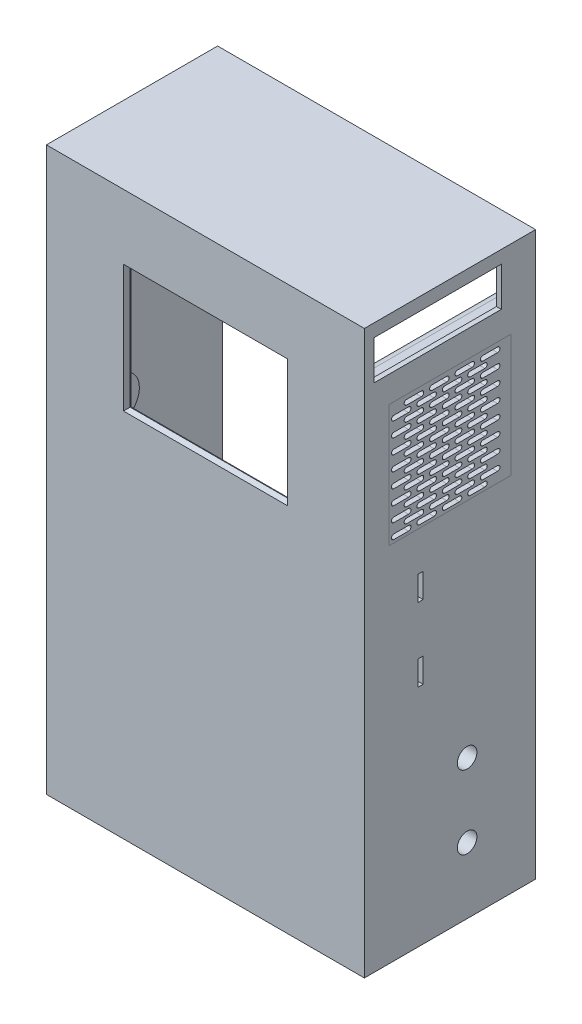
from build123d import *

# Parameters (mm, degrees)
SKETCH1_W                = 130
SKETCH1_H                = 230
CASE_2_DEPTH             = 70
CASE_SHELL_T             = -2
MONITOR_CUTOUT_REACH     = 151.499
SKETCH2_W                = 65
SKETCH2_H                = 50
SKETCH3_R                = 2.5
SKETCH3_R_2              = 1
MONITOR_STAND_DEPTH      = 4
MONITOR_CUTOUT_RIM_SIZE  = 1
MONITOR_CUTOUT_RIM_SIZE2 = 1.732050808
SKETCH17_R               = 4
PTC_HOLES_DEPTH          = 186.765981816
SKETCH27_R               = 3
BOSS_EXTRUDE5_DEPTH      = 2
BOSS_EXTRUDE6_START      = 4
BOSS_EXTRUDE6_DEPTH      = 2
SKETCH29_R               = 1
CUT_EXTRUDE8_DEPTH       = 3
CUT_EXTRUDE9_REACH       = 187.766
SKETCH30_W               = 52
SKETCH30_H               = 16
CUT_EXTRUDE10_REACH      = 187.766
SKETCH31_R               = 4
SKETCH33_W               = 8
SKETCH33_H               = 8
SKETCH33_R               = 1.5
BOSS_EXTRUDE8_DEPTH      = 68
FILLET1_R                = 4
EXTRUDE_THIN1_START      = 90
SKETCH15_W               = 10
SKETCH15_H               = 20
EXTRUDE_THIN1_DEPTH      = 40
SKETCH35_R               = 1.5
CUT_EXTRUDE11_DEPTH      = 10
CUT_EXTRUDE12_REACH      = 189.15
SKETCH36_W               = 2
SKETCH36_H               = 10
REVOLVE1_ANGLE           = 90
CUT_EXTRUDE15_REACH      = 151.499
SKETCH46_R               = 1.5
EXTRUDE_THIN2_START      = 5
SKETCH47_R               = 9
SKETCH47_R_2             = 4
EXTRUDE_THIN2_DEPTH      = 5
EXTRUDE_THIN3_START      = 5
SKETCH48_R               = 9
SKETCH48_R_2             = 4
EXTRUDE_THIN3_DEPTH      = 5
CUT_EXTRUDE16_REACH      = 189.15
FILL_START               = 63
FILL_PATTERN1_DEPTH      = 2


# Read off the part's stored shape, not the designer's step: Fill Pattern1
with BuildPart() as part:
    # Sketch1 → Case 2 (new body)
    with BuildSketch(Plane.XY):
        Rectangle(SKETCH1_W, SKETCH1_H)
    extrude(amount=CASE_2_DEPTH)

    # Case Shell
    case_shell_openings = [part.faces().sort_by_distance(p)[0] for p in [
        (0, 0, 0),
    ]]
    offset(amount=CASE_SHELL_T, openings=case_shell_openings, kind=Kind.INTERSECTION)

    # Sketch2 → Monitor Cutout (cut, up to next)
    with BuildSketch(Plane.XY.offset(70), mode=Mode.PRIVATE) as monitor_cutout_sk1:
        with Locations((0, 62.5)):
            Rectangle(SKETCH2_W, SKETCH2_H)
    monitor_cutout_tool1 = extrude(monitor_cutout_sk1.sketch, amount=-MONITOR_CUTOUT_REACH, mode=Mode.PRIVATE) & part.part
    add(monitor_cutout_tool1.solids().sort_by_distance((0, 62.5, 70))[0], mode=Mode.SUBTRACT)

    # Sketch3 → Monitor Stand (add)
    # profile 1 of 4: a face of its own
    with BuildSketch(Plane(origin=(0, 0, 68), x_dir=(-1, 0, 0), z_dir=(0, 0, -1))):
        with Locations(Location((43, 78.5, 0), (0, 0, 180))):
            Circle(SKETCH3_R)
        with Locations((43, 78.5)):
            Circle(SKETCH3_R_2, mode=Mode.SUBTRACT)
    # profile 2 of 4: a face of its own
    with BuildSketch(Plane(origin=(0, 0, 68), x_dir=(-1, 0, 0), z_dir=(0, 0, -1))):
        with Locations(Location((43, 46.5, 0), (0, 0, 180))):
            Circle(SKETCH3_R)
        with Locations((43, 46.5)):
            Circle(SKETCH3_R_2, mode=Mode.SUBTRACT)
    # profile 3 of 4: a face of its own
    with BuildSketch(Plane(origin=(0, 0, 68), x_dir=(-1, 0, 0), z_dir=(0, 0, -1))):
        with Locations(Location((-43, 46.5, 0), (0, 0, 180))):
            Circle(SKETCH3_R)
        with Locations((-43, 46.5)):
            Circle(SKETCH3_R_2, mode=Mode.SUBTRACT)
    # profile 4 of 4: a face of its own
    with BuildSketch(Plane(origin=(0, 0, 68), x_dir=(-1, 0, 0), z_dir=(0, 0, -1))):
        with Locations(Location((-43, 78.5, 0), (0, 0, 180))):
            Circle(SKETCH3_R)
        with Locations((-43, 78.5)):
            Circle(SKETCH3_R_2, mode=Mode.SUBTRACT)
    extrude(amount=MONITOR_STAND_DEPTH)

    # Monitor Cutout Rim
    monitor_cutout_rim_edges = [part.edges().sort_by_distance(p)[0] for p in [
        (32.5, 62.5, 70),
        (0, 87.5, 70),
        (-32.5, 62.5, 70),
        (0, 37.5, 70),
    ]]
    monitor_cutout_rim_side = [part.faces().sort_by_distance(p)[0] for p in [
        (0, -7.62195122, 70),
    ]]
    chamfer(monitor_cutout_rim_edges, length=MONITOR_CUTOUT_RIM_SIZE, length2=MONITOR_CUTOUT_RIM_SIZE2, reference=monitor_cutout_rim_side[0])

    # Sketch17 → PTC Holes (cut, through all)
    with BuildSketch(Plane.ZY.offset(-63)):
        with Locations(Location((28, -58, 0), (0, 0, 270))):
            Circle(SKETCH17_R)
        with Locations(Location((28, -88, 0), (0, 0, 270))):
            Circle(SKETCH17_R)
    extrude(amount=-PTC_HOLES_DEPTH, mode=Mode.SUBTRACT)

    # Sketch27 → Boss-Extrude5 (add)
    with BuildSketch(Plane.XZ.offset(-113)):
        with Locations(Location((39.5, 15.5, 0), (0, 0, 270))):
            Circle(SKETCH27_R)
        with Locations(Location((-18.5, 15.5, 0), (0, 0, 270))):
            Circle(SKETCH27_R)
        with BuildLine():
            Line((-21.5, 64.5), (-21.5, 68))
            Line((-21.5, 68), (-15.5, 68))
            Line((-15.5, 68), (-15.5, 64.5))
            ThreePointArc((-15.5, 64.5), (-18.5, 61.5), (-21.5, 64.5))
        make_face()
        with BuildLine():
            Line((36.5, 64.5), (36.5, 68))
            Line((36.5, 68), (42.5, 68))
            Line((42.5, 68), (42.5, 64.5))
            ThreePointArc((42.5, 64.5), (39.5, 61.5), (36.5, 64.5))
        make_face()
    extrude(amount=BOSS_EXTRUDE5_DEPTH)

    # Sketch28 → Boss-Extrude6 (add)
    with BuildSketch(Plane.XZ.offset(-113).offset(BOSS_EXTRUDE6_START)):
        with BuildLine():
            Line((-15.5, 64.5), (-15.5, 68))
            Line((-15.5, 68), (-21.5, 68))
            Line((-21.5, 68), (-21.5, 64.5))
            ThreePointArc((-21.5, 64.5), (-18.5, 61.5), (-15.5, 64.5))
        make_face()
        with BuildLine():
            Line((42.5, 64.5), (42.5, 68))
            Line((42.5, 68), (36.5, 68))
            Line((36.5, 68), (36.5, 64.5))
            ThreePointArc((36.5, 64.5), (39.5, 61.5), (42.5, 64.5))
        make_face()
    extrude(amount=BOSS_EXTRUDE6_DEPTH)

    # Sketch29 → Cut-Extrude8 (cut)
    with BuildSketch(Plane.XZ.offset(-111)):
        with Locations(Location((39.5, 15.5, 0), (0, 0, 270))):
            Circle(SKETCH29_R)
        with Locations(Location((-18.5, 15.5, 0), (0, 0, 270))):
            Circle(SKETCH29_R)
    extrude(amount=-CUT_EXTRUDE8_DEPTH, mode=Mode.SUBTRACT)

    # Sketch30 → Cut-Extrude9 (cut, up to next)
    with BuildSketch(Plane.ZY.offset(-63), mode=Mode.PRIVATE) as cut_extrude9_sk1:
        with Locations((40, 101.75)):
            Rectangle(SKETCH30_W, SKETCH30_H)
    cut_extrude9_tool1 = extrude(cut_extrude9_sk1.sketch, amount=-CUT_EXTRUDE9_REACH, mode=Mode.PRIVATE) & part.part
    add(cut_extrude9_tool1.solids().sort_by_distance((63, 101.75, 40))[0], mode=Mode.SUBTRACT)

    # Sketch31 → Cut-Extrude10 (cut, up to next)
    with BuildSketch(Plane(origin=(-63, 0, 0), x_dir=(0, 0, -1), z_dir=(1, 0, 0)), mode=Mode.PRIVATE) as cut_extrude10_sk1:
        with Locations(Location((-48, 17, 0), (0, 0, 90))):
            Circle(SKETCH31_R)
    cut_extrude10_tool1 = extrude(cut_extrude10_sk1.sketch, amount=-CUT_EXTRUDE10_REACH, mode=Mode.PRIVATE) & part.part
    add(cut_extrude10_tool1.solids().sort_by_distance((-63, 17, 48))[0], mode=Mode.SUBTRACT)

    # Sketch33 → Boss-Extrude8 (add)
    # profile 1 of 3: a face of its own
    with BuildSketch(Plane(origin=(0, 0, 0), x_dir=(-1, 0, 0), z_dir=(0, 0, -1))):
        with Locations((59, -109)):
            Rectangle(SKETCH33_W, SKETCH33_H)
        with Locations((59, -109)):
            Circle(SKETCH33_R, mode=Mode.SUBTRACT)
    # profile 2 of 3: a face of its own
    with BuildSketch(Plane(origin=(0, 0, 0), x_dir=(-1, 0, 0), z_dir=(0, 0, -1))):
        with Locations((59, 109)):
            Rectangle(SKETCH33_W, SKETCH33_H)
        with Locations((59, 109)):
            Circle(SKETCH33_R, mode=Mode.SUBTRACT)
    # profile 3 of 3: a face of its own
    with BuildSketch(Plane(origin=(0, 0, 0), x_dir=(-1, 0, 0), z_dir=(0, 0, -1))):
        with Locations((-59, 89)):
            Rectangle(SKETCH33_W, SKETCH33_H)
        with Locations((-59, 89)):
            Circle(SKETCH33_R, mode=Mode.SUBTRACT)
    extrude(amount=-BOSS_EXTRUDE8_DEPTH)

    # Fillet1
    fillet1_edges = [part.edges().sort_by_distance(p)[0] for p in [
        (-55, -105, 34),
        (-55, 105, 34),
        (55, 93, 34),
        (55, 85, 34),
    ]]
    fillet(fillet1_edges, radius=FILLET1_R - 0.0001)  # a hair under: the kernel refuses the full size

    # Sketch15 → Extrude-Thin1 (add)
    with BuildSketch(Plane(origin=(0, -113, 0), x_dir=(1, 0, 0), z_dir=(0, 1, 0)).offset(EXTRUDE_THIN1_START)):
        with Locations((8, -58)):
            Rectangle(SKETCH15_W, SKETCH15_H)
    extrude(amount=EXTRUDE_THIN1_DEPTH)

    # Sketch35 → Cut-Extrude11 (cut)
    with BuildSketch(Plane(origin=(0, 0, 48), x_dir=(-1, 0, 0), z_dir=(0, 0, -1))):
        with Locations((-8, 13)):
            Circle(SKETCH35_R)
        with Locations((-8, -19)):
            Circle(SKETCH35_R)
    extrude(amount=-CUT_EXTRUDE11_DEPTH, mode=Mode.SUBTRACT)

    # Sketch36 → Cut-Extrude12 (cut, up to next)
    with BuildSketch(Plane(origin=(65, 0, 0), x_dir=(0, 0, -1), z_dir=(1, 0, 0)), mode=Mode.PRIVATE) as cut_extrude12_sk1:
        with Locations((-47, 12)):
            Rectangle(SKETCH36_W, SKETCH36_H)
    cut_extrude12_tool1 = extrude(cut_extrude12_sk1.sketch, amount=-CUT_EXTRUDE12_REACH, mode=Mode.PRIVATE) & part.part
    # Sketch36 → Cut-Extrude12 (cut, up to next)
    with BuildSketch(Plane(origin=(65, 0, 0), x_dir=(0, 0, -1), z_dir=(1, 0, 0)), mode=Mode.PRIVATE) as cut_extrude12_sk2:
        with Locations((-47, -18)):
            Rectangle(SKETCH36_W, SKETCH36_H)
    cut_extrude12_tool2 = extrude(cut_extrude12_sk2.sketch, amount=-CUT_EXTRUDE12_REACH, mode=Mode.PRIVATE) & part.part
    add(cut_extrude12_tool1.solids().sort_by_distance((65, 12, 47))[0], mode=Mode.SUBTRACT)
    add(cut_extrude12_tool2.solids().sort_by_distance((65, -18, 47))[0], mode=Mode.SUBTRACT)

    # Sketch45 → Revolve1 (revolve)
    with BuildSketch(Plane(origin=(0, -113, 0), x_dir=(1, 0, 0), z_dir=(0, 1, 0))):
        with BuildLine():
            Line((63, 0), (48, 0))
            Line((48, 0), (48, -7.129153252))
            add(Edge.make_bspline(
                [(48, -7.129153252), (61.418377024, -15.580069757), (63, -33.841342958), (63, -48)],
                knots=[0, 0, 0, 0, 1, 1, 1, 1], degree=3))
            Line((63, -48), (63, 0))
        make_face()
    revolve(axis=Axis((63, -113, 48), (0, 0, -1)), revolution_arc=REVOLVE1_ANGLE)

    # Sketch46 → Cut-Extrude15 (cut, up to next)
    with BuildSketch(Plane(origin=(0, 0, 0), x_dir=(-1, 0, 0), z_dir=(0, 0, -1)), mode=Mode.PRIVATE) as cut_extrude15_sk1:
        with Locations((-59, -109)):
            Circle(SKETCH46_R)
    cut_extrude15_tool1 = extrude(cut_extrude15_sk1.sketch, amount=-CUT_EXTRUDE15_REACH, mode=Mode.PRIVATE) & part.part
    # Sketch46 → Cut-Extrude15 (cut, up to next)
    with BuildSketch(Plane(origin=(0, 0, 0), x_dir=(-1, 0, 0), z_dir=(0, 0, -1)), mode=Mode.PRIVATE) as cut_extrude15_sk2:
        with BuildLine():
            Line((-63, -105), (-59, -105))
            ThreePointArc((-59, -105), (-56.171572875, -106.171572875), (-55, -109))
            Line((-55, -109), (-55, -113))
            Line((-55, -113), (-42.52749649, -113))
            Line((-42.52749649, -113), (-42.52749649, -93.1550439))
            Line((-42.52749649, -93.1550439), (-63, -93.1550439))
            Line((-63, -93.1550439), (-63, -105))
        make_face()
    cut_extrude15_tool2 = extrude(cut_extrude15_sk2.sketch, amount=-CUT_EXTRUDE15_REACH, mode=Mode.PRIVATE) & part.part
    add(cut_extrude15_tool1.solids().sort_by_distance((59, -109, 0))[0], mode=Mode.SUBTRACT)
    add(cut_extrude15_tool2.solids().sort_by_distance((51.640338, -102.009083, 0))[0], mode=Mode.SUBTRACT)

    # Sketch47 → Extrude-Thin2 (add)
    with BuildSketch(Plane(origin=(-63, 0, 0), x_dir=(0, 0, -1), z_dir=(1, 0, 0)).offset(EXTRUDE_THIN2_START)):
        with Locations((-48, 17)):
            Circle(SKETCH47_R)
        with Locations((-48, 17)):
            Circle(SKETCH47_R_2, mode=Mode.SUBTRACT)
    extrude(amount=-EXTRUDE_THIN2_DEPTH)

    # Sketch48 → Extrude-Thin3 (add)
    # profile 1 of 2: a face of its own
    with BuildSketch(Plane.ZY.offset(-63).offset(EXTRUDE_THIN3_START)):
        with Locations((28, -88)):
            Circle(SKETCH48_R)
        with Locations((28, -88)):
            Circle(SKETCH48_R_2, mode=Mode.SUBTRACT)
    # profile 2 of 2: a face of its own
    with BuildSketch(Plane.ZY.offset(-63).offset(EXTRUDE_THIN3_START)):
        with Locations((28, -58)):
            Circle(SKETCH48_R)
        with Locations((28, -58)):
            Circle(SKETCH48_R_2, mode=Mode.SUBTRACT)
    extrude(amount=-EXTRUDE_THIN3_DEPTH)

    # Sketch50 → Cut-Extrude16 (cut, up to next)
    with BuildSketch(Plane(origin=(65, 0, 0), x_dir=(0, 0, -1), z_dir=(1, 0, 0)), mode=Mode.PRIVATE) as cut_extrude16_sk1:
        with BuildLine():
            Line((-47.540283586, 78.217417161), (-41.540283586, 78.217417161))
            ThreePointArc((-41.540283586, 78.217417161), (-40.540283586, 77.217417161), (-41.540283586, 76.217417161))
            Line((-41.540283586, 76.217417161), (-47.540283586, 76.217417161))
            ThreePointArc((-47.540283586, 76.217417161), (-48.540283586, 77.217417161), (-47.540283586, 78.217417161))
        make_face()
    cut_extrude16_tool1 = extrude(cut_extrude16_sk1.sketch, amount=-CUT_EXTRUDE16_REACH, mode=Mode.PRIVATE) & part.part
    add(cut_extrude16_tool1.solids().sort_by_distance((65, 77.217417, 44.540284))[0], mode=Mode.SUBTRACT)

    # Fill Pattern1 outline → Fill Pattern1 (cut)
    with BuildSketch(Plane.YZ.offset(FILL_START)):
        with BuildLine():
            ThreePointArc((76.217417161, 51.932588432), (77.217417161, 50.932588432), (78.217417161, 51.932588432))
            Line((78.217417161, 51.932588432), (78.217417161, 57.932588432))
            ThreePointArc((78.217417161, 57.932588432), (77.217417161, 58.932588432), (76.217417161, 57.932588432))
            Line((76.217417161, 57.932588432), (76.217417161, 51.932588432))
        make_face()
        with BuildLine():
            ThreePointArc((76.217417161, 31.147978741), (77.217417161, 30.147978741), (78.217417161, 31.147978741))
            Line((78.217417161, 31.147978741), (78.217417161, 37.147978741))
            ThreePointArc((78.217417161, 37.147978741), (77.217417161, 38.147978741), (76.217417161, 37.147978741))
            Line((76.217417161, 37.147978741), (76.217417161, 31.147978741))
        make_face()
        with BuildLine():
            ThreePointArc((76.217417161, 20.755673896), (77.217417161, 19.755673896), (78.217417161, 20.755673896))
            Line((78.217417161, 20.755673896), (78.217417161, 26.755673896))
            ThreePointArc((78.217417161, 26.755673896), (77.217417161, 27.755673896), (76.217417161, 26.755673896))
            Line((76.217417161, 26.755673896), (76.217417161, 20.755673896))
        make_face()
        with BuildLine():
            Line((36.217417161, 51.932588432), (36.217417161, 57.932588432))
            ThreePointArc((36.217417161, 57.932588432), (35.217417161, 58.932588432), (34.217417161, 57.932588432))
            Line((34.217417161, 57.932588432), (34.217417161, 51.932588432))
            ThreePointArc((34.217417161, 51.932588432), (35.217417161, 50.932588432), (36.217417161, 51.932588432))
        make_face()
        with BuildLine():
            ThreePointArc((34.217417161, 20.755673896), (35.217417161, 19.755673896), (36.217417161, 20.755673896))
            Line((36.217417161, 20.755673896), (36.217417161, 26.755673896))
            ThreePointArc((36.217417161, 26.755673896), (35.217417161, 27.755673896), (34.217417161, 26.755673896))
            Line((34.217417161, 26.755673896), (34.217417161, 20.755673896))
        make_face()
        with BuildLine():
            ThreePointArc((34.217417161, 31.147978741), (35.217417161, 30.147978741), (36.217417161, 31.147978741))
            Line((36.217417161, 31.147978741), (36.217417161, 37.147978741))
            ThreePointArc((36.217417161, 37.147978741), (35.217417161, 38.147978741), (34.217417161, 37.147978741))
            Line((34.217417161, 37.147978741), (34.217417161, 31.147978741))
        make_face()
        with BuildLine():
            ThreePointArc((34.217417161, 41.540283586), (35.217417161, 40.540283586), (36.217417161, 41.540283586))
            Line((36.217417161, 41.540283586), (36.217417161, 47.540283586))
            ThreePointArc((36.217417161, 47.540283586), (35.217417161, 48.540283586), (34.217417161, 47.540283586))
            Line((34.217417161, 47.540283586), (34.217417161, 41.540283586))
        make_face()
        with BuildLine():
            Line((60.217417161, 20.755673896), (60.217417161, 26.755673896))
            ThreePointArc((60.217417161, 26.755673896), (59.217417161, 27.755673896), (58.217417161, 26.755673896))
            Line((58.217417161, 26.755673896), (58.217417161, 20.755673896))
            ThreePointArc((58.217417161, 20.755673896), (59.217417161, 19.755673896), (60.217417161, 20.755673896))
        make_face()
        with BuildLine():
            ThreePointArc((58.217417161, 31.147978741), (59.217417161, 30.147978741), (60.217417161, 31.147978741))
            Line((60.217417161, 31.147978741), (60.217417161, 37.147978741))
            ThreePointArc((60.217417161, 37.147978741), (59.217417161, 38.147978741), (58.217417161, 37.147978741))
            Line((58.217417161, 37.147978741), (58.217417161, 31.147978741))
        make_face()
        with BuildLine():
            ThreePointArc((58.217417161, 41.540283586), (59.217417161, 40.540283586), (60.217417161, 41.540283586))
            Line((60.217417161, 41.540283586), (60.217417161, 47.540283586))
            ThreePointArc((60.217417161, 47.540283586), (59.217417161, 48.540283586), (58.217417161, 47.540283586))
            Line((58.217417161, 47.540283586), (58.217417161, 41.540283586))
        make_face()
        with BuildLine():
            ThreePointArc((58.217417161, 51.932588432), (59.217417161, 50.932588432), (60.217417161, 51.932588432))
            Line((60.217417161, 51.932588432), (60.217417161, 57.932588432))
            ThreePointArc((60.217417161, 57.932588432), (59.217417161, 58.932588432), (58.217417161, 57.932588432))
            Line((58.217417161, 57.932588432), (58.217417161, 51.932588432))
        make_face()
        with BuildLine():
            Line((63.217417161, 25.951826318), (63.217417161, 31.951826318))
            ThreePointArc((63.217417161, 31.951826318), (62.217417161, 32.951826318), (61.217417161, 31.951826318))
            Line((61.217417161, 31.951826318), (61.217417161, 25.951826318))
            ThreePointArc((61.217417161, 25.951826318), (62.217417161, 24.951826318), (63.217417161, 25.951826318))
        make_face()
        with BuildLine():
            ThreePointArc((61.217417161, 15.559521473), (62.217417161, 14.559521473), (63.217417161, 15.559521473))
            Line((63.217417161, 15.559521473), (63.217417161, 21.559521473))
            ThreePointArc((63.217417161, 21.559521473), (62.217417161, 22.559521473), (61.217417161, 21.559521473))
            Line((61.217417161, 21.559521473), (61.217417161, 15.559521473))
        make_face()
        with BuildLine():
            ThreePointArc((61.217417161, 36.344131164), (62.217417161, 35.344131164), (63.217417161, 36.344131164))
            Line((63.217417161, 36.344131164), (63.217417161, 42.344131164))
            ThreePointArc((63.217417161, 42.344131164), (62.217417161, 43.344131164), (61.217417161, 42.344131164))
            Line((61.217417161, 42.344131164), (61.217417161, 36.344131164))
        make_face()
        with BuildLine():
            ThreePointArc((61.217417161, 46.736436009), (62.217417161, 45.736436009), (63.217417161, 46.736436009))
            Line((63.217417161, 46.736436009), (63.217417161, 52.736436009))
            ThreePointArc((63.217417161, 52.736436009), (62.217417161, 53.736436009), (61.217417161, 52.736436009))
            Line((61.217417161, 52.736436009), (61.217417161, 46.736436009))
        make_face()
        with BuildLine():
            Line((66.217417161, 31.147978741), (66.217417161, 37.147978741))
            ThreePointArc((66.217417161, 37.147978741), (65.217417161, 38.147978741), (64.217417161, 37.147978741))
            Line((64.217417161, 37.147978741), (64.217417161, 31.147978741))
            ThreePointArc((64.217417161, 31.147978741), (65.217417161, 30.147978741), (66.217417161, 31.147978741))
        make_face()
        with BuildLine():
            ThreePointArc((64.217417161, 41.540283586), (65.217417161, 40.540283586), (66.217417161, 41.540283586))
            Line((66.217417161, 41.540283586), (66.217417161, 47.540283586))
            ThreePointArc((66.217417161, 47.540283586), (65.217417161, 48.540283586), (64.217417161, 47.540283586))
            Line((64.217417161, 47.540283586), (64.217417161, 41.540283586))
        make_face()
        with BuildLine():
            ThreePointArc((64.217417161, 20.755673896), (65.217417161, 19.755673896), (66.217417161, 20.755673896))
            Line((66.217417161, 20.755673896), (66.217417161, 26.755673896))
            ThreePointArc((66.217417161, 26.755673896), (65.217417161, 27.755673896), (64.217417161, 26.755673896))
            Line((64.217417161, 26.755673896), (64.217417161, 20.755673896))
        make_face()
        with BuildLine():
            ThreePointArc((64.217417161, 51.932588432), (65.217417161, 50.932588432), (66.217417161, 51.932588432))
            Line((66.217417161, 51.932588432), (66.217417161, 57.932588432))
            ThreePointArc((66.217417161, 57.932588432), (65.217417161, 58.932588432), (64.217417161, 57.932588432))
            Line((64.217417161, 57.932588432), (64.217417161, 51.932588432))
        make_face()
        with BuildLine():
            Line((69.217417161, 36.344131164), (69.217417161, 42.344131164))
            ThreePointArc((69.217417161, 42.344131164), (68.217417161, 43.344131164), (67.217417161, 42.344131164))
            Line((67.217417161, 42.344131164), (67.217417161, 36.344131164))
            ThreePointArc((67.217417161, 36.344131164), (68.217417161, 35.344131164), (69.217417161, 36.344131164))
        make_face()
        with BuildLine():
            ThreePointArc((67.217417161, 46.736436009), (68.217417161, 45.736436009), (69.217417161, 46.736436009))
            Line((69.217417161, 46.736436009), (69.217417161, 52.736436009))
            ThreePointArc((69.217417161, 52.736436009), (68.217417161, 53.736436009), (67.217417161, 52.736436009))
            Line((67.217417161, 52.736436009), (67.217417161, 46.736436009))
        make_face()
        with BuildLine():
            ThreePointArc((67.217417161, 25.951826318), (68.217417161, 24.951826318), (69.217417161, 25.951826318))
            Line((69.217417161, 25.951826318), (69.217417161, 31.951826318))
            ThreePointArc((69.217417161, 31.951826318), (68.217417161, 32.951826318), (67.217417161, 31.951826318))
            Line((67.217417161, 31.951826318), (67.217417161, 25.951826318))
        make_face()
        with BuildLine():
            ThreePointArc((67.217417161, 15.559521473), (68.217417161, 14.559521473), (69.217417161, 15.559521473))
            Line((69.217417161, 15.559521473), (69.217417161, 21.559521473))
            ThreePointArc((69.217417161, 21.559521473), (68.217417161, 22.559521473), (67.217417161, 21.559521473))
            Line((67.217417161, 21.559521473), (67.217417161, 15.559521473))
        make_face()
        with BuildLine():
            Line((75.217417161, 46.736436009), (75.217417161, 52.736436009))
            ThreePointArc((75.217417161, 52.736436009), (74.217417161, 53.736436009), (73.217417161, 52.736436009))
            Line((73.217417161, 52.736436009), (73.217417161, 46.736436009))
            ThreePointArc((73.217417161, 46.736436009), (74.217417161, 45.736436009), (75.217417161, 46.736436009))
        make_face()
        with BuildLine():
            ThreePointArc((73.217417161, 15.559521473), (74.217417161, 14.559521473), (75.217417161, 15.559521473))
            Line((75.217417161, 15.559521473), (75.217417161, 21.559521473))
            ThreePointArc((75.217417161, 21.559521473), (74.217417161, 22.559521473), (73.217417161, 21.559521473))
            Line((73.217417161, 21.559521473), (73.217417161, 15.559521473))
        make_face()
        with BuildLine():
            ThreePointArc((73.217417161, 36.344131164), (74.217417161, 35.344131164), (75.217417161, 36.344131164))
            Line((75.217417161, 36.344131164), (75.217417161, 42.344131164))
            ThreePointArc((75.217417161, 42.344131164), (74.217417161, 43.344131164), (73.217417161, 42.344131164))
            Line((73.217417161, 42.344131164), (73.217417161, 36.344131164))
        make_face()
        with BuildLine():
            ThreePointArc((73.217417161, 25.951826318), (74.217417161, 24.951826318), (75.217417161, 25.951826318))
            Line((75.217417161, 25.951826318), (75.217417161, 31.951826318))
            ThreePointArc((75.217417161, 31.951826318), (74.217417161, 32.951826318), (73.217417161, 31.951826318))
            Line((73.217417161, 31.951826318), (73.217417161, 25.951826318))
        make_face()
        with BuildLine():
            Line((72.217417161, 41.540283586), (72.217417161, 47.540283586))
            ThreePointArc((72.217417161, 47.540283586), (71.217417161, 48.540283586), (70.217417161, 47.540283586))
            Line((70.217417161, 47.540283586), (70.217417161, 41.540283586))
            ThreePointArc((70.217417161, 41.540283586), (71.217417161, 40.540283586), (72.217417161, 41.540283586))
        make_face()
        with BuildLine():
            ThreePointArc((70.217417161, 51.932588432), (71.217417161, 50.932588432), (72.217417161, 51.932588432))
            Line((72.217417161, 51.932588432), (72.217417161, 57.932588432))
            ThreePointArc((72.217417161, 57.932588432), (71.217417161, 58.932588432), (70.217417161, 57.932588432))
            Line((70.217417161, 57.932588432), (70.217417161, 51.932588432))
        make_face()
        with BuildLine():
            ThreePointArc((70.217417161, 31.147978741), (71.217417161, 30.147978741), (72.217417161, 31.147978741))
            Line((72.217417161, 31.147978741), (72.217417161, 37.147978741))
            ThreePointArc((72.217417161, 37.147978741), (71.217417161, 38.147978741), (70.217417161, 37.147978741))
            Line((70.217417161, 37.147978741), (70.217417161, 31.147978741))
        make_face()
        with BuildLine():
            ThreePointArc((70.217417161, 20.755673896), (71.217417161, 19.755673896), (72.217417161, 20.755673896))
            Line((72.217417161, 20.755673896), (72.217417161, 26.755673896))
            ThreePointArc((72.217417161, 26.755673896), (71.217417161, 27.755673896), (70.217417161, 26.755673896))
            Line((70.217417161, 26.755673896), (70.217417161, 20.755673896))
        make_face()
        with BuildLine():
            Line((54.217417161, 20.755673896), (54.217417161, 26.755673896))
            ThreePointArc((54.217417161, 26.755673896), (53.217417161, 27.755673896), (52.217417161, 26.755673896))
            Line((52.217417161, 26.755673896), (52.217417161, 20.755673896))
            ThreePointArc((52.217417161, 20.755673896), (53.217417161, 19.755673896), (54.217417161, 20.755673896))
        make_face()
        with BuildLine():
            ThreePointArc((52.217417161, 51.932588432), (53.217417161, 50.932588432), (54.217417161, 51.932588432))
            Line((54.217417161, 51.932588432), (54.217417161, 57.932588432))
            ThreePointArc((54.217417161, 57.932588432), (53.217417161, 58.932588432), (52.217417161, 57.932588432))
            Line((52.217417161, 57.932588432), (52.217417161, 51.932588432))
        make_face()
        with BuildLine():
            ThreePointArc((52.217417161, 31.147978741), (53.217417161, 30.147978741), (54.217417161, 31.147978741))
            Line((54.217417161, 31.147978741), (54.217417161, 37.147978741))
            ThreePointArc((54.217417161, 37.147978741), (53.217417161, 38.147978741), (52.217417161, 37.147978741))
            Line((52.217417161, 37.147978741), (52.217417161, 31.147978741))
        make_face()
        with BuildLine():
            ThreePointArc((52.217417161, 41.540283586), (53.217417161, 40.540283586), (54.217417161, 41.540283586))
            Line((54.217417161, 41.540283586), (54.217417161, 47.540283586))
            ThreePointArc((54.217417161, 47.540283586), (53.217417161, 48.540283586), (52.217417161, 47.540283586))
            Line((52.217417161, 47.540283586), (52.217417161, 41.540283586))
        make_face()
        with BuildLine():
            Line((57.217417161, 25.951826318), (57.217417161, 31.951826318))
            ThreePointArc((57.217417161, 31.951826318), (56.217417161, 32.951826318), (55.217417161, 31.951826318))
            Line((55.217417161, 31.951826318), (55.217417161, 25.951826318))
            ThreePointArc((55.217417161, 25.951826318), (56.217417161, 24.951826318), (57.217417161, 25.951826318))
        make_face()
        with BuildLine():
            ThreePointArc((55.217417161, 15.559521473), (56.217417161, 14.559521473), (57.217417161, 15.559521473))
            Line((57.217417161, 15.559521473), (57.217417161, 21.559521473))
            ThreePointArc((57.217417161, 21.559521473), (56.217417161, 22.559521473), (55.217417161, 21.559521473))
            Line((55.217417161, 21.559521473), (55.217417161, 15.559521473))
        make_face()
        with BuildLine():
            ThreePointArc((55.217417161, 36.344131164), (56.217417161, 35.344131164), (57.217417161, 36.344131164))
            Line((57.217417161, 36.344131164), (57.217417161, 42.344131164))
            ThreePointArc((57.217417161, 42.344131164), (56.217417161, 43.344131164), (55.217417161, 42.344131164))
            Line((55.217417161, 42.344131164), (55.217417161, 36.344131164))
        make_face()
        with BuildLine():
            ThreePointArc((55.217417161, 46.736436009), (56.217417161, 45.736436009), (57.217417161, 46.736436009))
            Line((57.217417161, 46.736436009), (57.217417161, 52.736436009))
            ThreePointArc((57.217417161, 52.736436009), (56.217417161, 53.736436009), (55.217417161, 52.736436009))
            Line((55.217417161, 52.736436009), (55.217417161, 46.736436009))
        make_face()
        with BuildLine():
            Line((81.217417161, 36.344131164), (81.217417161, 42.344131164))
            ThreePointArc((81.217417161, 42.344131164), (80.217417161, 43.344131164), (79.217417161, 42.344131164))
            Line((79.217417161, 42.344131164), (79.217417161, 36.344131164))
            ThreePointArc((79.217417161, 36.344131164), (80.217417161, 35.344131164), (81.217417161, 36.344131164))
        make_face()
        with BuildLine():
            ThreePointArc((79.217417161, 25.951826318), (80.217417161, 24.951826318), (81.217417161, 25.951826318))
            Line((81.217417161, 25.951826318), (81.217417161, 31.951826318))
            ThreePointArc((81.217417161, 31.951826318), (80.217417161, 32.951826318), (79.217417161, 31.951826318))
            Line((79.217417161, 31.951826318), (79.217417161, 25.951826318))
        make_face()
        with BuildLine():
            ThreePointArc((79.217417161, 15.559521473), (80.217417161, 14.559521473), (81.217417161, 15.559521473))
            Line((81.217417161, 15.559521473), (81.217417161, 21.559521473))
            ThreePointArc((81.217417161, 21.559521473), (80.217417161, 22.559521473), (79.217417161, 21.559521473))
            Line((79.217417161, 21.559521473), (79.217417161, 15.559521473))
        make_face()
        with BuildLine():
            ThreePointArc((79.217417161, 46.736436009), (80.217417161, 45.736436009), (81.217417161, 46.736436009))
            Line((81.217417161, 46.736436009), (81.217417161, 52.736436009))
            ThreePointArc((81.217417161, 52.736436009), (80.217417161, 53.736436009), (79.217417161, 52.736436009))
            Line((79.217417161, 52.736436009), (79.217417161, 46.736436009))
        make_face()
        with BuildLine():
            Line((39.217417161, 25.951826318), (39.217417161, 31.951826318))
            ThreePointArc((39.217417161, 31.951826318), (38.217417161, 32.951826318), (37.217417161, 31.951826318))
            Line((37.217417161, 31.951826318), (37.217417161, 25.951826318))
            ThreePointArc((37.217417161, 25.951826318), (38.217417161, 24.951826318), (39.217417161, 25.951826318))
        make_face()
        with BuildLine():
            ThreePointArc((37.217417161, 15.559521473), (38.217417161, 14.559521473), (39.217417161, 15.559521473))
            Line((39.217417161, 15.559521473), (39.217417161, 21.559521473))
            ThreePointArc((39.217417161, 21.559521473), (38.217417161, 22.559521473), (37.217417161, 21.559521473))
            Line((37.217417161, 21.559521473), (37.217417161, 15.559521473))
        make_face()
        with BuildLine():
            ThreePointArc((37.217417161, 46.736436009), (38.217417161, 45.736436009), (39.217417161, 46.736436009))
            Line((39.217417161, 46.736436009), (39.217417161, 52.736436009))
            ThreePointArc((39.217417161, 52.736436009), (38.217417161, 53.736436009), (37.217417161, 52.736436009))
            Line((37.217417161, 52.736436009), (37.217417161, 46.736436009))
        make_face()
        with BuildLine():
            ThreePointArc((37.217417161, 36.344131164), (38.217417161, 35.344131164), (39.217417161, 36.344131164))
            Line((39.217417161, 36.344131164), (39.217417161, 42.344131164))
            ThreePointArc((39.217417161, 42.344131164), (38.217417161, 43.344131164), (37.217417161, 42.344131164))
            Line((37.217417161, 42.344131164), (37.217417161, 36.344131164))
        make_face()
        with BuildLine():
            Line((42.217417161, 31.147978741), (42.217417161, 37.147978741))
            ThreePointArc((42.217417161, 37.147978741), (41.217417161, 38.147978741), (40.217417161, 37.147978741))
            Line((40.217417161, 37.147978741), (40.217417161, 31.147978741))
            ThreePointArc((40.217417161, 31.147978741), (41.217417161, 30.147978741), (42.217417161, 31.147978741))
        make_face()
        with BuildLine():
            ThreePointArc((40.217417161, 51.932588432), (41.217417161, 50.932588432), (42.217417161, 51.932588432))
            Line((42.217417161, 51.932588432), (42.217417161, 57.932588432))
            ThreePointArc((42.217417161, 57.932588432), (41.217417161, 58.932588432), (40.217417161, 57.932588432))
            Line((40.217417161, 57.932588432), (40.217417161, 51.932588432))
        make_face()
        with BuildLine():
            ThreePointArc((40.217417161, 41.540283586), (41.217417161, 40.540283586), (42.217417161, 41.540283586))
            Line((42.217417161, 41.540283586), (42.217417161, 47.540283586))
            ThreePointArc((42.217417161, 47.540283586), (41.217417161, 48.540283586), (40.217417161, 47.540283586))
            Line((40.217417161, 47.540283586), (40.217417161, 41.540283586))
        make_face()
        with BuildLine():
            ThreePointArc((40.217417161, 20.755673896), (41.217417161, 19.755673896), (42.217417161, 20.755673896))
            Line((42.217417161, 20.755673896), (42.217417161, 26.755673896))
            ThreePointArc((42.217417161, 26.755673896), (41.217417161, 27.755673896), (40.217417161, 26.755673896))
            Line((40.217417161, 26.755673896), (40.217417161, 20.755673896))
        make_face()
        with BuildLine():
            Line((45.217417161, 36.344131164), (45.217417161, 42.344131164))
            ThreePointArc((45.217417161, 42.344131164), (44.217417161, 43.344131164), (43.217417161, 42.344131164))
            Line((43.217417161, 42.344131164), (43.217417161, 36.344131164))
            ThreePointArc((43.217417161, 36.344131164), (44.217417161, 35.344131164), (45.217417161, 36.344131164))
        make_face()
        with BuildLine():
            ThreePointArc((43.217417161, 46.736436009), (44.217417161, 45.736436009), (45.217417161, 46.736436009))
            Line((45.217417161, 46.736436009), (45.217417161, 52.736436009))
            ThreePointArc((45.217417161, 52.736436009), (44.217417161, 53.736436009), (43.217417161, 52.736436009))
            Line((43.217417161, 52.736436009), (43.217417161, 46.736436009))
        make_face()
        with BuildLine():
            ThreePointArc((43.217417161, 25.951826318), (44.217417161, 24.951826318), (45.217417161, 25.951826318))
            Line((45.217417161, 25.951826318), (45.217417161, 31.951826318))
            ThreePointArc((45.217417161, 31.951826318), (44.217417161, 32.951826318), (43.217417161, 31.951826318))
            Line((43.217417161, 31.951826318), (43.217417161, 25.951826318))
        make_face()
        with BuildLine():
            ThreePointArc((43.217417161, 15.559521473), (44.217417161, 14.559521473), (45.217417161, 15.559521473))
            Line((45.217417161, 15.559521473), (45.217417161, 21.559521473))
            ThreePointArc((45.217417161, 21.559521473), (44.217417161, 22.559521473), (43.217417161, 21.559521473))
            Line((43.217417161, 21.559521473), (43.217417161, 15.559521473))
        make_face()
        with BuildLine():
            Line((51.217417161, 46.736436009), (51.217417161, 52.736436009))
            ThreePointArc((51.217417161, 52.736436009), (50.217417161, 53.736436009), (49.217417161, 52.736436009))
            Line((49.217417161, 52.736436009), (49.217417161, 46.736436009))
            ThreePointArc((49.217417161, 46.736436009), (50.217417161, 45.736436009), (51.217417161, 46.736436009))
        make_face()
        with BuildLine():
            ThreePointArc((49.217417161, 25.951826318), (50.217417161, 24.951826318), (51.217417161, 25.951826318))
            Line((51.217417161, 25.951826318), (51.217417161, 31.951826318))
            ThreePointArc((51.217417161, 31.951826318), (50.217417161, 32.951826318), (49.217417161, 31.951826318))
            Line((49.217417161, 31.951826318), (49.217417161, 25.951826318))
        make_face()
        with BuildLine():
            ThreePointArc((49.217417161, 15.559521473), (50.217417161, 14.559521473), (51.217417161, 15.559521473))
            Line((51.217417161, 15.559521473), (51.217417161, 21.559521473))
            ThreePointArc((51.217417161, 21.559521473), (50.217417161, 22.559521473), (49.217417161, 21.559521473))
            Line((49.217417161, 21.559521473), (49.217417161, 15.559521473))
        make_face()
        with BuildLine():
            ThreePointArc((49.217417161, 36.344131164), (50.217417161, 35.344131164), (51.217417161, 36.344131164))
            Line((51.217417161, 36.344131164), (51.217417161, 42.344131164))
            ThreePointArc((51.217417161, 42.344131164), (50.217417161, 43.344131164), (49.217417161, 42.344131164))
            Line((49.217417161, 42.344131164), (49.217417161, 36.344131164))
        make_face()
        with BuildLine():
            Line((48.217417161, 41.540283586), (48.217417161, 47.540283586))
            ThreePointArc((48.217417161, 47.540283586), (47.217417161, 48.540283586), (46.217417161, 47.540283586))
            Line((46.217417161, 47.540283586), (46.217417161, 41.540283586))
            ThreePointArc((46.217417161, 41.540283586), (47.217417161, 40.540283586), (48.217417161, 41.540283586))
        make_face()
        with BuildLine():
            ThreePointArc((46.217417161, 51.932588432), (47.217417161, 50.932588432), (48.217417161, 51.932588432))
            Line((48.217417161, 51.932588432), (48.217417161, 57.932588432))
            ThreePointArc((48.217417161, 57.932588432), (47.217417161, 58.932588432), (46.217417161, 57.932588432))
            Line((46.217417161, 57.932588432), (46.217417161, 51.932588432))
        make_face()
        with BuildLine():
            ThreePointArc((46.217417161, 20.755673896), (47.217417161, 19.755673896), (48.217417161, 20.755673896))
            Line((48.217417161, 20.755673896), (48.217417161, 26.755673896))
            ThreePointArc((48.217417161, 26.755673896), (47.217417161, 27.755673896), (46.217417161, 26.755673896))
            Line((46.217417161, 26.755673896), (46.217417161, 20.755673896))
        make_face()
        with BuildLine():
            ThreePointArc((46.217417161, 31.147978741), (47.217417161, 30.147978741), (48.217417161, 31.147978741))
            Line((48.217417161, 31.147978741), (48.217417161, 37.147978741))
            ThreePointArc((48.217417161, 37.147978741), (47.217417161, 38.147978741), (46.217417161, 37.147978741))
            Line((46.217417161, 37.147978741), (46.217417161, 31.147978741))
        make_face()
    extrude(amount=FILL_PATTERN1_DEPTH, mode=Mode.SUBTRACT)


solid = part.part
